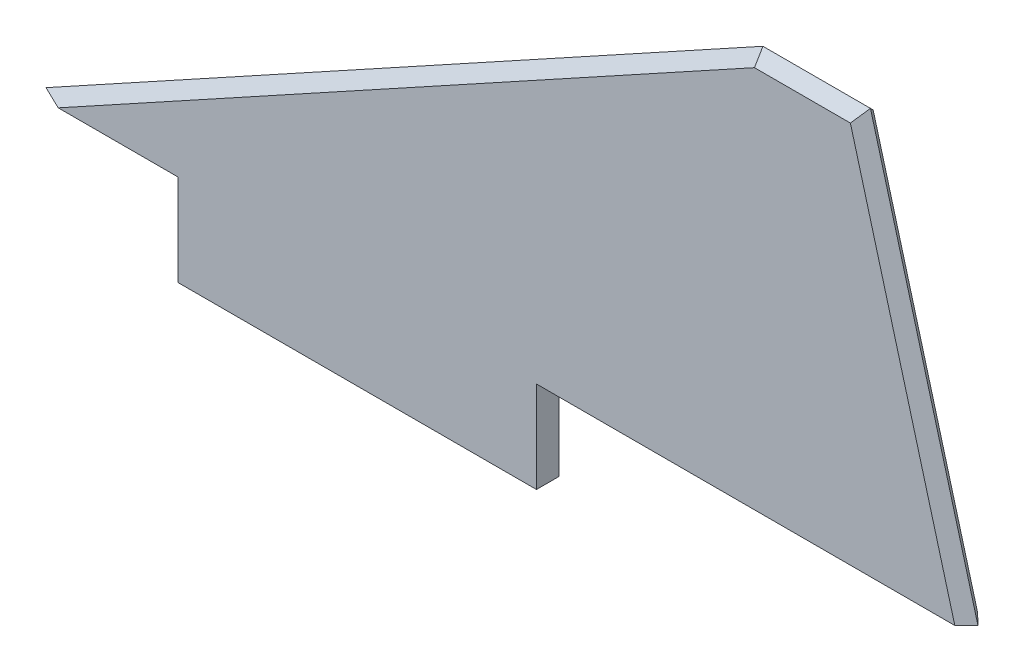
from build123d import *

# Parameters (mm, degrees)
BOSS_EXTRUDE1_DEPTH = 3.175
CHAMFER1_SIZE       = 1.5875


with BuildPart() as part:
    # Sketch1 → Boss-Extrude1 (new body)
    with BuildSketch(Plane.XY):
        Polygon((0, 0), (20, 0), (20, -12.75), (70, -12.75), (70, 0), (130, 0), (115, 55), (100, 55), align=None)
    extrude(amount=BOSS_EXTRUDE1_DEPTH)

    # Chamfer1
    chamfer1_edges = [part.edges().sort_by_distance(p)[0] for p in [
        (50, 27.5, 3.175),
        (107.5, 55, 3.175),
        (122.5, 27.5, 3.175),
        (50, 27.5, 0),
        (107.5, 55, 0),
        (122.5, 27.5, 0),
    ]]
    chamfer(chamfer1_edges, length=CHAMFER1_SIZE - 0.0001)  # a hair under: the kernel refuses the full size


solid = part.part
